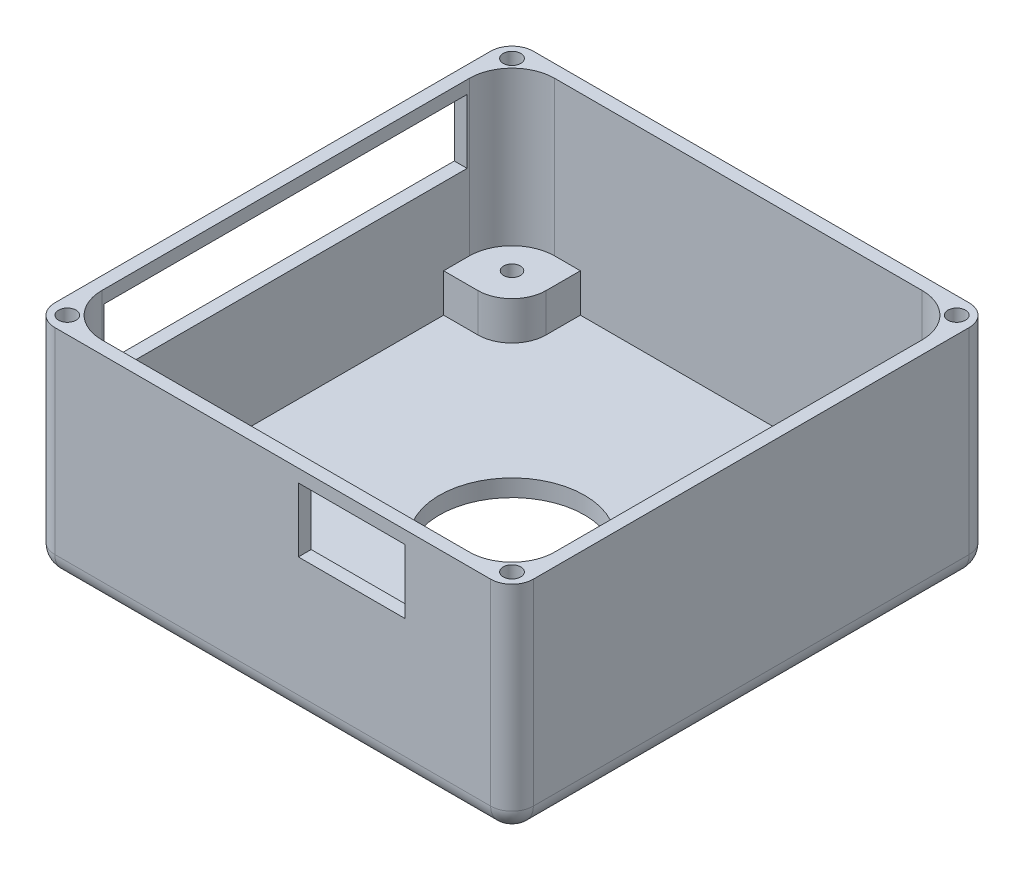
from build123d import *

# Parameters (mm, degrees)
SKETCH_1_W                     = 112
SKETCH_1_H                     = 112
SKETCH_1_W_2                   = 106
SKETCH_1_H_2                   = 106
EXTRUDE_1_DEPTH                = 45
SKETCH_3_W                     = 112
SKETCH_3_H                     = 112
EXTRUDE_2_DEPTH                = 6
SKETCH_4_R                     = 28.5
CUT_EXTRUDE_2_DEPTH            = 2
SKETCH_5_R                     = 2.05
CUT_EXTRUDE_3_DEPTH            = 3
SKETCH_6_R                     = 17
CUT_EXTRUDE_4_DEPTH            = 6
EXTRUDE_3_DEPTH                = 9
FILLET_1_R                     = 5
SKETCH_8_W                     = 85
SKETCH_8_H                     = 15
CUT_EXTRUDE_5_DEPTH            = 5
SKETCH_9_W                     = 25
SKETCH_9_H                     = 15
CUT_EXTRUDE_6_DEPTH            = 5
SKETCH_10_R                    = 2.05
CUT_EXTRUDE_7_DEPTH            = 5
FILLET_5_R                     = 5
HOLE_WIZARD_M3_5_2_D           = 3.9
HOLE_WIZARD_M3_5_2_CSINK_D     = 7.7
HOLE_WIZARD_M3_5_2_CSINK_ANGLE = 90
FILLET_START                   = 9
FILLET_7_DEPTH                 = 31
FILLET_START_2                 = 40
FILLET_7_2_DEPTH               = 5


with BuildPart() as part:
    # 草图1 → 凸台-拉伸1 (new body)
    with BuildSketch(Plane(origin=(0, 0, 0), x_dir=(1, 0, 0), z_dir=(0, 1, 0))):
        Rectangle(SKETCH_1_W, SKETCH_1_H)
        Rectangle(SKETCH_1_W_2, SKETCH_1_H_2, mode=Mode.SUBTRACT)
    extrude(amount=EXTRUDE_1_DEPTH)

    # 草图3 → 凸台-拉伸2 (add)
    with BuildSketch(Plane.XZ):
        Rectangle(SKETCH_3_W, SKETCH_3_H)
    extrude(amount=EXTRUDE_2_DEPTH)

    # 草图4 → 切除-拉伸2 (cut)
    with BuildSketch(Plane.XZ.offset(6)):
        with Locations(Location((0, 0, 0), (0, 0, 270))):
            Circle(SKETCH_4_R)
    extrude(amount=-CUT_EXTRUDE_2_DEPTH, mode=Mode.SUBTRACT)

    # 草图5 → 切除-拉伸3 (cut)
    with BuildSketch(Plane(origin=(0, -4, 0), x_dir=(-1, 0, 0), z_dir=(0, -1, 0))):
        with Locations(Location((0, -22.5, 0), (0, 0, 90))):
            Circle(SKETCH_5_R)
        with Locations(Location((-22.5, 0, 0), (0, 0, 90))):
            Circle(SKETCH_5_R)
        with Locations(Location((22.5, 0, 0), (0, 0, 90))):
            Circle(SKETCH_5_R)
        with Locations(Location((0, 22.5, 0), (0, 0, 90))):
            Circle(SKETCH_5_R)
    extrude(amount=-CUT_EXTRUDE_3_DEPTH, mode=Mode.SUBTRACT)

    # 草图6 → 切除-拉伸4 (cut)
    with BuildSketch(Plane.XZ.offset(4)):
        with Locations(Location((0, 0, 0), (0, 0, 270))):
            Circle(SKETCH_6_R)
    extrude(amount=-CUT_EXTRUDE_4_DEPTH, mode=Mode.SUBTRACT)

    # 草图7 → 凸台-拉伸3 (add)
    with BuildSketch(Plane(origin=(0, 0, 0), x_dir=(1, 0, 0), z_dir=(0, 1, 0))):
        with BuildLine():
            Line((-45, 37), (-53, 37))
            Line((-53, 37), (-53, 53))
            Line((-53, 53), (-37, 53))
            Line((-37, 53), (-37, 45))
            ThreePointArc((-37, 45), (-39.343145751, 39.343145751), (-45, 37))
        make_face()
        with BuildLine():
            Line((-45, -37), (-53, -37))
            Line((-53, -37), (-53, -53))
            Line((-53, -53), (-37, -53))
            Line((-37, -53), (-37, -45))
            ThreePointArc((-37, -45), (-39.343145751, -39.343145751), (-45, -37))
        make_face()
        with BuildLine():
            Line((45, -39), (53, -39))
            Line((53, -39), (53, -53))
            Line((53, -53), (39, -53))
            Line((39, -53), (39, -45))
            ThreePointArc((39, -45), (41, -41), (45, -39))
        make_face()
        with BuildLine():
            Line((45, 37), (53, 37))
            Line((53, 37), (53, 53))
            Line((53, 53), (37, 53))
            Line((37, 53), (37, 45))
            ThreePointArc((37, 45), (39.343145751, 39.343145751), (45, 37))
        make_face()
    extrude(amount=EXTRUDE_3_DEPTH)

    # 圆角1
    fillet_1_edges = [part.edges().sort_by_distance(p)[0] for p in [
        (56, 19.5, 56),
        (-56, 19.5, 56),
        (-56, 19.5, -56),
        (56, 19.5, -56),
    ]]
    fillet(fillet_1_edges, radius=FILLET_1_R)

    # 草图8 → 切除-拉伸5 (cut)
    with BuildSketch(Plane.ZY.offset(56)):
        with Locations((0, 34.5)):
            Rectangle(SKETCH_8_W, SKETCH_8_H)
    extrude(amount=-CUT_EXTRUDE_5_DEPTH, mode=Mode.SUBTRACT)

    # 草图9 → 切除-拉伸6 (cut)
    with BuildSketch(Plane.XY.offset(56)):
        with Locations((18.5, 34.5)):
            Rectangle(SKETCH_9_W, SKETCH_9_H)
    extrude(amount=-CUT_EXTRUDE_6_DEPTH, mode=Mode.SUBTRACT)

    # 草图10 → 切除-拉伸7 (cut)
    with BuildSketch(Plane(origin=(0, 45, 0), x_dir=(1, 0, 0), z_dir=(0, 1, 0))):
        with Locations((52.035533906, -52.035533906)):
            Circle(SKETCH_10_R)
        with Locations((-52.035533906, -52.035533906)):
            Circle(SKETCH_10_R)
        with Locations((-52.035533906, 52.035533906)):
            Circle(SKETCH_10_R)
        with Locations((52.035533906, 52.035533906)):
            Circle(SKETCH_10_R)
    extrude(amount=-CUT_EXTRUDE_7_DEPTH, mode=Mode.SUBTRACT)

    # 圆角5
    fillet_5_edges = [part.edges().sort_by_distance(p)[0] for p in [
        (56, -6, 0),
        (-56, -6, 0),
        (0, -6, -56),
        (0, -6, 56),
        (-54.535533906, -6, 54.535533906),
        (-54.535533906, -6, -54.535533906),
        (54.535533906, -6, -54.535533906),
        (54.535533906, -6, 54.535533906),
    ]]
    fillet(fillet_5_edges, radius=FILLET_5_R)

    # M3.5 十字槽半沉头木螺钉的锥形沉头孔2 (through all)
    with Locations(Plane(origin=(0, -6, 0), x_dir=(-1, 0, 0), z_dir=(0, -1, 0))):
        with Locations((0, 0), (45, -45), (-45, 45), (-45, -45), (45, 45)):
            CounterSinkHole(HOLE_WIZARD_M3_5_2_D / 2, HOLE_WIZARD_M3_5_2_CSINK_D / 2, counter_sink_angle=HOLE_WIZARD_M3_5_2_CSINK_ANGLE)

    # 圆角7: read off the stored shape, not the designer's step
    # 圆角7 outline → 圆角7 (add)
    with BuildSketch(Plane(origin=(0, 0, 0), x_dir=(1, 0, 0), z_dir=(0, 1, 0)).offset(FILLET_START)):
        with BuildLine():
            Line((53, -53), (53, -43))
            ThreePointArc((53, -43), (50.071067812, -50.071067812), (43, -53))
            Line((43, -53), (53, -53))
        make_face()
        with BuildLine():
            ThreePointArc((43, 53), (50.071067812, 50.071067812), (53, 43))
            Line((53, 43), (53, 53))
            Line((53, 53), (43, 53))
        make_face()
        with BuildLine():
            ThreePointArc((-43, -53), (-50.071067812, -50.071067812), (-53, -43))
            Line((-53, -43), (-53, -53))
            Line((-53, -53), (-43, -53))
        make_face()
        with BuildLine():
            ThreePointArc((-53, 43), (-50.071067812, 50.071067812), (-43, 53))
            Line((-43, 53), (-53, 53))
            Line((-53, 53), (-53, 43))
        make_face()
    extrude(amount=FILLET_7_DEPTH)

    # Fillet 7 2 outline → Fillet 7 2 (add)
    with BuildSketch(Plane(origin=(0, 0, 0), x_dir=(1, 0, 0), z_dir=(0, 1, 0)).offset(FILLET_START_2)):
        with BuildLine():
            ThreePointArc((50.22658251, -53), (50.585965005, -50.585965005), (53, -50.22658251))
            Line((53, -50.22658251), (53, -43))
            ThreePointArc((53, -43), (50.071067812, -50.071067812), (43, -53))
            Line((43, -53), (50.22658251, -53))
        make_face()
        with BuildLine():
            ThreePointArc((43, 53), (50.071067812, 50.071067812), (53, 43))
            Line((53, 43), (53, 50.22658251))
            ThreePointArc((53, 50.22658251), (50.585965005, 50.585965005), (50.22658251, 53))
            Line((50.22658251, 53), (43, 53))
        make_face()
        with BuildLine():
            Line((-50.22658251, -53), (-43, -53))
            ThreePointArc((-43, -53), (-50.071067812, -50.071067812), (-53, -43))
            Line((-53, -43), (-53, -50.22658251))
            ThreePointArc((-53, -50.22658251), (-50.585965005, -50.585965005), (-50.22658251, -53))
        make_face()
        with BuildLine():
            ThreePointArc((-53, 43), (-50.071067812, 50.071067812), (-43, 53))
            Line((-43, 53), (-50.22658251, 53))
            ThreePointArc((-50.22658251, 53), (-50.585965005, 50.585965005), (-53, 50.22658251))
            Line((-53, 50.22658251), (-53, 43))
        make_face()
    extrude(amount=FILLET_7_2_DEPTH)


solid = part.part
